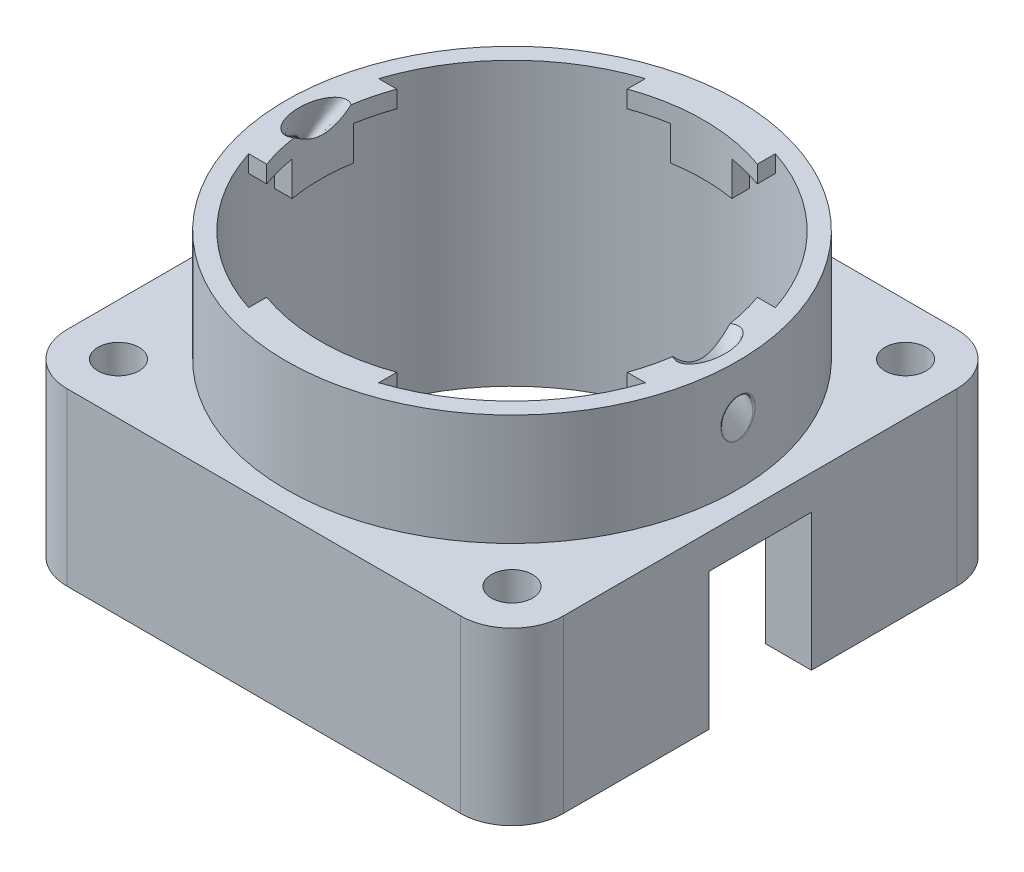
from build123d import *

# Parameters (mm, degrees)
SKETCH1_R                = 13.2
SKETCH1_R_2              = 12.2
BOSS_EXTRUDE1_DEPTH      = 2
SKETCH4_R                = 13.2
SKETCH4_R_2              = 12.2
BOSS_EXTRUDE2_DEPTH      = 14.5
BOSS_EXTRUDE3_DEPTH      = 1
BOSS_EXTRUDE4_DEPTH      = 2
FILLET2_R                = 0.1
CIRPATTERN2_COUNT        = 2
FILLET2_OF_CIRPATTERN2_R = 0.1
BOSS_EXTRUDE5_DEPTH      = 4
BOSS_EXTRUDE5_DEPTH_BACK = 6
SKETCH24_W               = 29
SKETCH24_H               = 29
SKETCH24_R               = 13.2
SKETCH24_R_2             = 1.2
FILLET3_R                = 3
SKETCH27_W               = 6
SKETCH27_H               = 8
CUT_EXTRUDE2_DEPTH       = 10


with BuildPart() as part:
    # Sketch1 → Boss-Extrude1 (new body)
    with BuildSketch(Plane(origin=(0, 0, 0), x_dir=(1, 0, 0), z_dir=(0, 1, 0))):
        with Locations(Location((0, 0, 0), (0, 0, 270))):
            Circle(SKETCH1_R)
        with Locations(Location((0, 0, 0), (0, 0, 270))):
            Circle(SKETCH1_R_2, mode=Mode.SUBTRACT)
    extrude(amount=-BOSS_EXTRUDE1_DEPTH)

    # Sketch4 → Boss-Extrude2 (add)
    with BuildSketch(Plane(origin=(0, -2, 0), x_dir=(1, 0, 0), z_dir=(0, 1, 0))):
        with Locations(Location((0, 0, 0), (0, 0, 270))):
            Circle(SKETCH4_R)
        with Locations(Location((0, 0, 0), (0, 0, 270))):
            Circle(SKETCH4_R_2, mode=Mode.SUBTRACT)
    extrude(amount=-BOSS_EXTRUDE2_DEPTH)

    # Sketch13 → Boss-Extrude3 (add)
    with BuildSketch(Plane(origin=(0, 0, 0), x_dir=(1, 0, 0), z_dir=(0, 1, 0))):
        with BuildLine():
            Line((10.535653753, -3.8), (11.593101397, -3.8))
            ThreePointArc((11.593101397, -3.8), (12.2, 0), (11.593101397, 3.8))
            Line((11.593101397, 3.8), (10.535653753, 3.8))
            ThreePointArc((10.535653753, 3.8), (11.2, 0), (10.535653753, -3.8))
        make_face()
        with BuildLine():
            Line((-3.8, -10.535653753), (-3.8, -11.593101397))
            ThreePointArc((-3.8, -11.593101397), (0, -12.2), (3.8, -11.593101397))
            Line((3.8, -11.593101397), (3.8, -10.535653753))
            ThreePointArc((3.8, -10.535653753), (0, -11.2), (-3.8, -10.535653753))
        make_face()
        with BuildLine():
            Line((-3.8, 11.593101397), (-3.8, 10.535653753))
            ThreePointArc((-3.8, 10.535653753), (0, 11.2), (3.8, 10.535653753))
            Line((3.8, 10.535653753), (3.8, 11.593101397))
            ThreePointArc((3.8, 11.593101397), (0, 12.2), (-3.8, 11.593101397))
        make_face()
        with BuildLine():
            Line((-10.535653753, 3.8), (-11.593101397, 3.8))
            ThreePointArc((-11.593101397, 3.8), (-12.2, 0), (-11.593101397, -3.8))
            Line((-11.593101397, -3.8), (-10.535653753, -3.8))
            ThreePointArc((-10.535653753, -3.8), (-11.2, 0), (-10.535653753, 3.8))
        make_face()
    extrude(amount=-BOSS_EXTRUDE3_DEPTH)

    # Sketch19 → Boss-Extrude4 (add)
    with BuildSketch(Plane.XZ.offset(1)):
        with BuildLine():
            Line((-1.8, 12.066482503), (-1.8, 11.054410884))
            ThreePointArc((-1.8, 11.054410884), (0, 11.2), (1.8, 11.054410884))
            Line((1.8, 11.054410884), (1.8, 12.066482503))
            ThreePointArc((1.8, 12.066482503), (0, 12.2), (-1.8, 12.066482503))
        make_face()
        with BuildLine():
            Line((12.066482503, -1.8), (11.054410884, -1.8))
            ThreePointArc((11.054410884, -1.8), (11.2, 0), (11.054410884, 1.8))
            Line((11.054410884, 1.8), (12.066482503, 1.8))
            ThreePointArc((12.066482503, 1.8), (12.2, 0), (12.066482503, -1.8))
        make_face()
        with BuildLine():
            Line((-1.8, -12.066482503), (-1.8, -11.054410884))
            ThreePointArc((-1.8, -11.054410884), (0, -11.2), (1.8, -11.054410884))
            Line((1.8, -11.054410884), (1.8, -12.066482503))
            ThreePointArc((1.8, -12.066482503), (0, -12.2), (-1.8, -12.066482503))
        make_face()
        with BuildLine():
            Line((-12.066482503, 1.8), (-11.054410884, 1.8))
            ThreePointArc((-11.054410884, 1.8), (-11.2, 0), (-11.054410884, -1.8))
            Line((-11.054410884, -1.8), (-12.066482503, -1.8))
            ThreePointArc((-12.066482503, -1.8), (-12.2, 0), (-12.066482503, 1.8))
        make_face()
    extrude(amount=BOSS_EXTRUDE4_DEPTH)

    # Cut-Loft4: read off the stored shape, not the designer's step
    # Cut-Loft4: loft between two sections, ruled curve by curve
    cut_loft4_from = [
        Edge.make_bspline([(10.776522895, 0, -1.330574549), (12.254939061, 0, -3.755092125), (13.60189327, 0, -1.093943027), (12.123477105, 0, 1.330574549), (10.645060939, 0, 3.755092125), (9.29810673, 0, 1.093943027), (10.776522895, 0, -1.330574549)], [0, 0, 0, 0, 0.5, 0.5, 0.5, 1, 1, 1, 1], 3, [1, 0.333333333, 0.333333333, 1, 0.333333333, 0.333333333, 1]),
    ]
    cut_loft4_to = [
        Edge.make_bspline([(13.2, -2.131057351, -0.494912793), (13.2, -1.141231764, 1.242972504), (13.2, -2.879117062, 2.232798091), (13.2, -3.868942649, 0.494912793), (13.2, -4.858768236, -1.242972504), (13.2, -3.120882938, -2.232798091), (13.2, -2.131057351, -0.494912793)], [0, 0, 0, 0, 0.5, 0.5, 0.5, 1, 1, 1, 1], 3, [1, 0.333333333, 0.333333333, 1, 0.333333333, 0.333333333, 1]),
    ]
    cut_loft4 = Solid(Shell([*[Face.make_surface_from_curves(cut_loft4_from[k], cut_loft4_to[k]) for k in range(1)], Face(Wire(cut_loft4_from)), Face(Wire(cut_loft4_to))]))
    add(cut_loft4, mode=Mode.SUBTRACT)

    # Fillet2
    fillet2_edges = [part.edges().sort_by_distance(p)[0] for p in [
        (13.166439278, -2.97935843, 0.940678861),
    ]]
    fillet(fillet2_edges, radius=FILLET2_R)

    # CirPattern2: Cut-Loft4 ×2 about axis
    cirpattern2_axis = Axis((0, 0, 0), (0, 1, 0))
    for i in range(1, CIRPATTERN2_COUNT):
        add(cut_loft4.rotate(cirpattern2_axis, i * 360 / CIRPATTERN2_COUNT), mode=Mode.SUBTRACT)

    # Fillet2 of CirPattern2
    fillet2_of_cirpattern2_edges = [part.edges().sort_by_distance(p)[0] for p in [
        (-13.166439278, -2.97935843, -0.940678861),
    ]]
    fillet(fillet2_of_cirpattern2_edges, radius=FILLET2_OF_CIRPATTERN2_R)

    # Sketch24 → Boss-Extrude5 (add, two sides: drawn at the far end of the back side and taken through both)
    with BuildSketch(Plane(origin=(0, -10.5, 0), x_dir=(1, 0, 0), z_dir=(0, 1, 0)).offset(-BOSS_EXTRUDE5_DEPTH_BACK)):
        Rectangle(SKETCH24_W, SKETCH24_H)
        with Locations(Location((0, 0, 0), (0, 0, 270))):
            Circle(SKETCH24_R, mode=Mode.SUBTRACT)
        with Locations(Location((-11.5, 11.5, 0), (0, 0, 270))):
            Circle(SKETCH24_R_2, mode=Mode.SUBTRACT)
        with Locations(Location((11.5, 11.5, 0), (0, 0, 90))):
            Circle(SKETCH24_R_2, mode=Mode.SUBTRACT)
        with Locations(Location((11.5, -11.5, 0), (0, 0, 270))):
            Circle(SKETCH24_R_2, mode=Mode.SUBTRACT)
        with Locations(Location((-11.5, -11.5, 0), (0, 0, 90))):
            Circle(SKETCH24_R_2, mode=Mode.SUBTRACT)
    extrude(amount=BOSS_EXTRUDE5_DEPTH + BOSS_EXTRUDE5_DEPTH_BACK)

    # Fillet3
    fillet3_edges = [part.edges().sort_by_distance(p)[0] for p in [
        (-14.5, -11.5, 14.5),
        (-14.5, -11.5, -14.5),
        (14.5, -11.5, -14.5),
        (14.5, -11.5, 14.5),
    ]]
    fillet(fillet3_edges, radius=FILLET3_R)

    # Sketch27 → Cut-Extrude2 (cut)
    with BuildSketch(Plane(origin=(14.5, 0, 0), x_dir=(0, 0, -1), z_dir=(1, 0, 0))):
        with Locations((0, -12.5)):
            Rectangle(SKETCH27_W, SKETCH27_H)
    extrude(amount=-CUT_EXTRUDE2_DEPTH, mode=Mode.SUBTRACT)


solid = part.part
